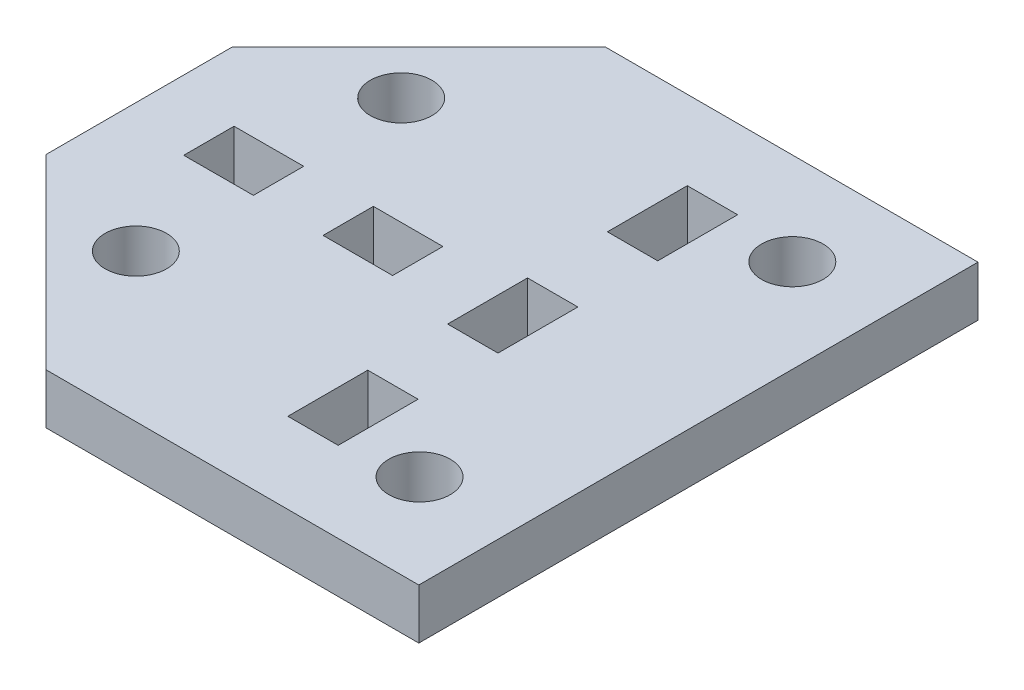
from build123d import *

# Parameters (mm, degrees)
SKETCH1_R           = 1.65
SKETCH1_W           = 2.7
SKETCH1_H           = 4.285714286
SKETCH1_H_2         = 4.285714285
SKETCH1_W_2         = 3.730008568
SKETCH1_H_3         = 2.7
BOSS_EXTRUDE1_DEPTH = 2.7


with BuildPart() as part:
    # Sketch1 → Boss-Extrude1 (new body)
    with BuildSketch(Plane(origin=(0, 0, 0), x_dir=(1, 0, 0), z_dir=(0, 1, 0))):
        Polygon((10.776704041, -15.946127132), (-9.223295959, -15.946127132), (-19.223295959, -5.946127132), (-19.223295959, 4.053872868), (-9.223295959, 14.053872868), (10.776704041, 14.053872868), align=None)
        with Locations((-12.32618077, -8.023001304)):
            Circle(SKETCH1_R, mode=Mode.SUBTRACT)
        with Locations((5.776704041, -10.906154715)):
            Circle(SKETCH1_R, mode=Mode.SUBTRACT)
        with Locations((5.776704041, 9.093845285)):
            Circle(SKETCH1_R, mode=Mode.SUBTRACT)
        with Locations((-12.32618077, 6.210691875)):
            Circle(SKETCH1_R, mode=Mode.SUBTRACT)
        with Locations((0.776704041, -9.477583286)):
            Rectangle(SKETCH1_W, SKETCH1_H, mode=Mode.SUBTRACT)
        with Locations((0.776704041, -0.906154715)):
            Rectangle(SKETCH1_W, SKETCH1_H, mode=Mode.SUBTRACT)
        with Locations((0.776704041, 7.665273857)):
            Rectangle(SKETCH1_W, SKETCH1_H_2, mode=Mode.SUBTRACT)
        Polygon((-15.493295959, 0.411867351), (-11.763295959, 0.419861835), (-11.763295959, -2.280138165), (-15.493295959, -2.288132649), align=None, mode=Mode.SUBTRACT)
        with Locations((-6.168291675, -0.922143682)):
            Rectangle(SKETCH1_W_2, SKETCH1_H_3, mode=Mode.SUBTRACT)
    extrude(amount=-BOSS_EXTRUDE1_DEPTH)


solid = part.part
